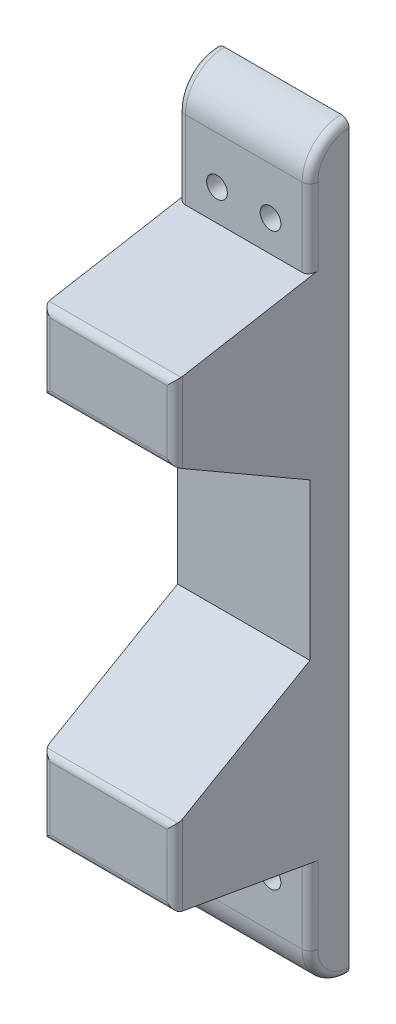
from build123d import *
from build123d.topology import SkipClean

# Parameters (mm, degrees)
SKETCH_1_W      = 33.865609136
SKETCH_1_H      = 190
SKETCH_1_R      = 2.65
EXTRUDE_1_DEPTH = 10
FILLET_1_R      = 10
EXTRUDE_2_DEPTH = 33.865609
FILLET_2_R      = 2


# Some blends are built 0.0001 mm under size
with BuildPart() as part:
    # 草图1 → 凸台-拉伸1 (new body)
    with BuildSketch(Plane.XY):
        Rectangle(SKETCH_1_W, SKETCH_1_H)
        with Locations((-6.85, 73)):
            Circle(SKETCH_1_R, mode=Mode.SUBTRACT)
        with Locations(Location((6.85, 73, 0), (0, 0, 180))):
            Circle(SKETCH_1_R, mode=Mode.SUBTRACT)
        with Locations(Location((-6.85, -73, 0), (0, 0, 180))):
            Circle(SKETCH_1_R, mode=Mode.SUBTRACT)
        with Locations((6.85, -73)):
            Circle(SKETCH_1_R, mode=Mode.SUBTRACT)
    extrude(amount=EXTRUDE_1_DEPTH)

    # 圆角1
    fillet_1_edges = [part.edges().sort_by_distance(p)[0] for p in [
        (0, -95, 10),
        (0, 95, 10),
    ]]
    fillet(fillet_1_edges, radius=FILLET_1_R - 0.0001)  # a hair under: the kernel refuses the full size

    # 草图2 → 凸台-拉伸2 (add, through all)
    with SkipClean():  # the faces are left unmerged after this step: merging them gives an invalid solid
        with BuildSketch(Plane.ZY.offset(16.932804568)):
            Polygon((44.6, 58.899086467), (10, 65), (10, 20), (44.6, 39.976319314), align=None)
            Polygon((44.6, -39.976319314), (10, -20), (10, -65), (44.6, -58.899086467), align=None)
        extrude(amount=-EXTRUDE_2_DEPTH)

    # 圆角2
    # the kernel refuses this fillet: 2 mm, written as the material it takes off along each edge
    with BuildSketch(Plane(origin=(16.932804568, -85.0001, 10), x_dir=(0, 0, -1), z_dir=(0, 1, 0))) as fillet_2_piece_1_section:
        with BuildLine():
            CenterArc((FILLET_2_R, FILLET_2_R), FILLET_2_R, 180, 90)
            Line((0, FILLET_2_R), (0, 0))
            Line((0, 0), (FILLET_2_R, 0))
        make_face()
    fillet_2_piece_1 = extrude(amount=25.0001, mode=Mode.PRIVATE)
    fillet_2_piece_1 = split(fillet_2_piece_1, bisect_by=Plane(origin=(16.479042192, -65.37988803, 7.84554792), z_dir=(0, -0.9848077530122075, 0.17364817766693394)), keep=Keep.TOP, mode=Mode.PRIVATE)
    add(fillet_2_piece_1, mode=Mode.SUBTRACT)
    with BuildSketch(Plane(origin=(-16.932804568, 85.0001, 10), x_dir=(0, 0, -1), z_dir=(0, -1, 0))) as fillet_2_piece_2_section:
        with BuildLine():
            CenterArc((FILLET_2_R, FILLET_2_R), FILLET_2_R, 180, 90)
            Line((0, FILLET_2_R), (0, 0))
            Line((0, 0), (FILLET_2_R, 0))
        make_face()
    fillet_2_piece_2 = extrude(amount=25.0001, mode=Mode.PRIVATE)
    fillet_2_piece_2 = split(fillet_2_piece_2, bisect_by=Plane(origin=(-16.479042192, 65.37988803, 7.84554792), z_dir=(0, 0.9848077530122075, 0.17364817766693394)), keep=Keep.TOP, mode=Mode.PRIVATE)
    add(fillet_2_piece_2, mode=Mode.SUBTRACT)
    with BuildSketch(Plane(origin=(16.932804568, 85.0001, 0.0001), x_dir=(0, 1, 0), z_dir=(0, 0, -1))) as fillet_2_piece_3:
        with BuildLine():
            CenterArc((9.9999 - FILLET_2_R, -FILLET_2_R), FILLET_2_R, 0, 90)
            Line((9.9999, -FILLET_2_R), (9.9999, 0))
            Line((9.9999, 0), (9.9999 - FILLET_2_R, 0))
        make_face()
    revolve(axis=Axis((16.932804568, 85.0001, 0.0001), (1, 0, 0)), revolution_arc=90, mode=Mode.SUBTRACT)
    with BuildSketch(Plane(origin=(16.932804568, -85.0001, 0.0001), x_dir=(0, -1, 0), z_dir=(0, 0, -1))) as fillet_2_piece_4:
        with BuildLine():
            CenterArc((9.9999 - FILLET_2_R, FILLET_2_R), FILLET_2_R, 270, 90)
            Line((9.9999 - FILLET_2_R, 0), (9.9999, 0))
            Line((9.9999, 0), (9.9999, FILLET_2_R))
        make_face()
    revolve(axis=Axis((16.932804568, -85.0001, 0.0001), (-1, 0, 0)), revolution_arc=90, mode=Mode.SUBTRACT)
    with BuildSketch(Plane(origin=(-16.932804568, 85.0001, 0.0001), x_dir=(0, 1, 0), z_dir=(0, 0, -1))) as fillet_2_piece_5:
        with BuildLine():
            CenterArc((9.9999 - FILLET_2_R, FILLET_2_R), FILLET_2_R, 270, 90)
            Line((9.9999, FILLET_2_R), (9.9999, 0))
            Line((9.9999, 0), (9.9999 - FILLET_2_R, 0))
        make_face()
    revolve(axis=Axis((-16.932804568, 85.0001, 0.0001), (1, 0, 0)), revolution_arc=90, mode=Mode.SUBTRACT)
    with BuildSketch(Plane(origin=(-16.932804568, -85.0001, 0.0001), x_dir=(0, -1, 0), z_dir=(0, 0, -1))) as fillet_2_piece_6:
        with BuildLine():
            CenterArc((9.9999 - FILLET_2_R, -FILLET_2_R), FILLET_2_R, 0, 90)
            Line((9.9999, -FILLET_2_R), (9.9999, 0))
            Line((9.9999, 0), (9.9999 - FILLET_2_R, 0))
        make_face()
    revolve(axis=Axis((-16.932804568, -85.0001, 0.0001), (-1, 0, 0)), revolution_arc=90, mode=Mode.SUBTRACT)
    with BuildSketch(Plane(origin=(16.932804568, 60, 10), x_dir=(0, 0, -1), z_dir=(0, 1, 0))) as fillet_2_piece_7_section:
        with BuildLine():
            CenterArc((FILLET_2_R, FILLET_2_R), FILLET_2_R, 180, 90)
            Line((0, FILLET_2_R), (0, 0))
            Line((0, 0), (FILLET_2_R, 0))
        make_face()
    fillet_2_piece_7 = extrude(amount=25.0001, mode=Mode.PRIVATE)
    fillet_2_piece_7 = split(fillet_2_piece_7, bisect_by=Plane(origin=(16.479042192, 65.37988803, 7.84554792), z_dir=(0, 0.9848077530122075, 0.17364817766693394)), keep=Keep.TOP, mode=Mode.PRIVATE)
    add(fillet_2_piece_7, mode=Mode.SUBTRACT)
    with BuildSketch(Plane(origin=(-19.819555914, 39.976319314, 44.6), x_dir=(0, -0.5000000000000052, -0.8660254037844355), z_dir=(1, 0, 0))) as fillet_2_piece_8:
        with BuildLine():
            CenterArc((FILLET_2_R * 0.57735026919, FILLET_2_R), FILLET_2_R, 210, 60)
            Line((-FILLET_2_R * 0.288675134595, FILLET_2_R * 0.5), (0, 0))
            Line((0, 0), (FILLET_2_R * 0.57735026919, 0))
        make_face()
    extrude(amount=39.639111692, mode=Mode.SUBTRACT)
    with BuildSketch(Plane(origin=(-16.932804568, 34.976319314, 44.6), x_dir=(0, 0, -1), z_dir=(0, 1, 0)), Plane(origin=(-16.932804568, -63.899086467, 44.6), x_dir=(0, 0, -1), z_dir=(0, 1, 0))) as fillet_2_piece_9:
        with BuildLine():
            CenterArc((FILLET_2_R, -FILLET_2_R), FILLET_2_R, 90, 90)
            Line((0, -FILLET_2_R), (0, 0))
            Line((0, 0), (FILLET_2_R, 0))
        make_face()
    extrude(amount=28.922767154, mode=Mode.SUBTRACT)
    with BuildSketch(Plane(origin=(-21.128302724, 58.899086467, 44.6), x_dir=(0, 0.17364817766693522, -0.9848077530122071), z_dir=(1, 0, 0))) as fillet_2_piece_10:
        with BuildLine():
            CenterArc((FILLET_2_R * 0.839099631177, -FILLET_2_R), FILLET_2_R, 90, 80)
            Line((-FILLET_2_R * 0.145708121835, -FILLET_2_R * 0.826351822333), (0, 0))
            Line((0, 0), (FILLET_2_R * 0.839099631177, 0))
        make_face()
    extrude(amount=42.256605312, mode=Mode.SUBTRACT)
    with BuildSketch(Plane(origin=(16.932804432, 34.976319314, 44.6), x_dir=(0, 0, -1), z_dir=(0, 1, 0)), Plane(origin=(16.932804432, -63.899086467, 44.6), x_dir=(0, 0, -1), z_dir=(0, 1, 0))) as fillet_2_piece_11:
        with BuildLine():
            CenterArc((FILLET_2_R, FILLET_2_R), FILLET_2_R, 180, 90)
            Line((0, FILLET_2_R), (0, 0))
            Line((0, 0), (FILLET_2_R, 0))
        make_face()
    extrude(amount=28.922767154, mode=Mode.SUBTRACT)
    with BuildSketch(Plane(origin=(-16.932804568, -60, 10), x_dir=(0, 0, -1), z_dir=(0, -1, 0))) as fillet_2_piece_12_section:
        with BuildLine():
            CenterArc((FILLET_2_R, FILLET_2_R), FILLET_2_R, 180, 90)
            Line((0, FILLET_2_R), (0, 0))
            Line((0, 0), (FILLET_2_R, 0))
        make_face()
    fillet_2_piece_12 = extrude(amount=25.0001, mode=Mode.PRIVATE)
    fillet_2_piece_12 = split(fillet_2_piece_12, bisect_by=Plane(origin=(-16.479042192, -65.37988803, 7.84554792), z_dir=(0, -0.9848077530122075, 0.17364817766693394)), keep=Keep.TOP, mode=Mode.PRIVATE)
    add(fillet_2_piece_12, mode=Mode.SUBTRACT)
    with BuildSketch(Plane(origin=(-19.819555914, -39.976319314, 44.6), x_dir=(0, 0.5000000000000052, -0.8660254037844355), z_dir=(1, 0, 0))) as fillet_2_piece_13:
        with BuildLine():
            CenterArc((FILLET_2_R * 0.57735026919, -FILLET_2_R), FILLET_2_R, 90, 60)
            Line((-FILLET_2_R * 0.288675134595, -FILLET_2_R * 0.5), (0, 0))
            Line((0, 0), (FILLET_2_R * 0.57735026919, 0))
        make_face()
    extrude(amount=39.639111692, mode=Mode.SUBTRACT)
    with BuildSketch(Plane(origin=(-21.128302724, -58.899086467, 44.6), x_dir=(0, -0.17364817766693183, -0.9848077530122078), z_dir=(1, 0, 0))) as fillet_2_piece_14:
        with BuildLine():
            CenterArc((FILLET_2_R * 0.839099631177, FILLET_2_R), FILLET_2_R, 190, 80)
            Line((-FILLET_2_R * 0.145708121835, FILLET_2_R * 0.826351822333), (0, 0))
            Line((0, 0), (FILLET_2_R * 0.839099631177, 0))
        make_face()
    extrude(amount=42.256605312, mode=Mode.SUBTRACT)
    with BuildSketch(Plane(origin=(-16.932804568, -95, -5), x_dir=(1, 0, 0), z_dir=(0, 0, 1)), Plane(origin=(-16.932804568, 95, -5), x_dir=(0, -1, 0), z_dir=(0, 0, 1))) as fillet_2_piece_15:
        with BuildLine():
            CenterArc((FILLET_2_R, FILLET_2_R), FILLET_2_R, 180, 90)
            Line((0, FILLET_2_R), (0, 0))
            Line((0, 0), (FILLET_2_R, 0))
        make_face()
    extrude(amount=5.0001, mode=Mode.SUBTRACT)
    with BuildSketch(Plane(origin=(16.932804568, -95, -5), x_dir=(-1, 0, 0), z_dir=(0, 0, 1)), Plane(origin=(16.932804568, 95, -5), x_dir=(0, -1, 0), z_dir=(0, 0, 1))) as fillet_2_piece_16:
        with BuildLine():
            CenterArc((FILLET_2_R, -FILLET_2_R), FILLET_2_R, 90, 90)
            Line((0, -FILLET_2_R), (0, 0))
            Line((0, 0), (FILLET_2_R, 0))
        make_face()
    extrude(amount=5.0001, mode=Mode.SUBTRACT)


solid = part.part
